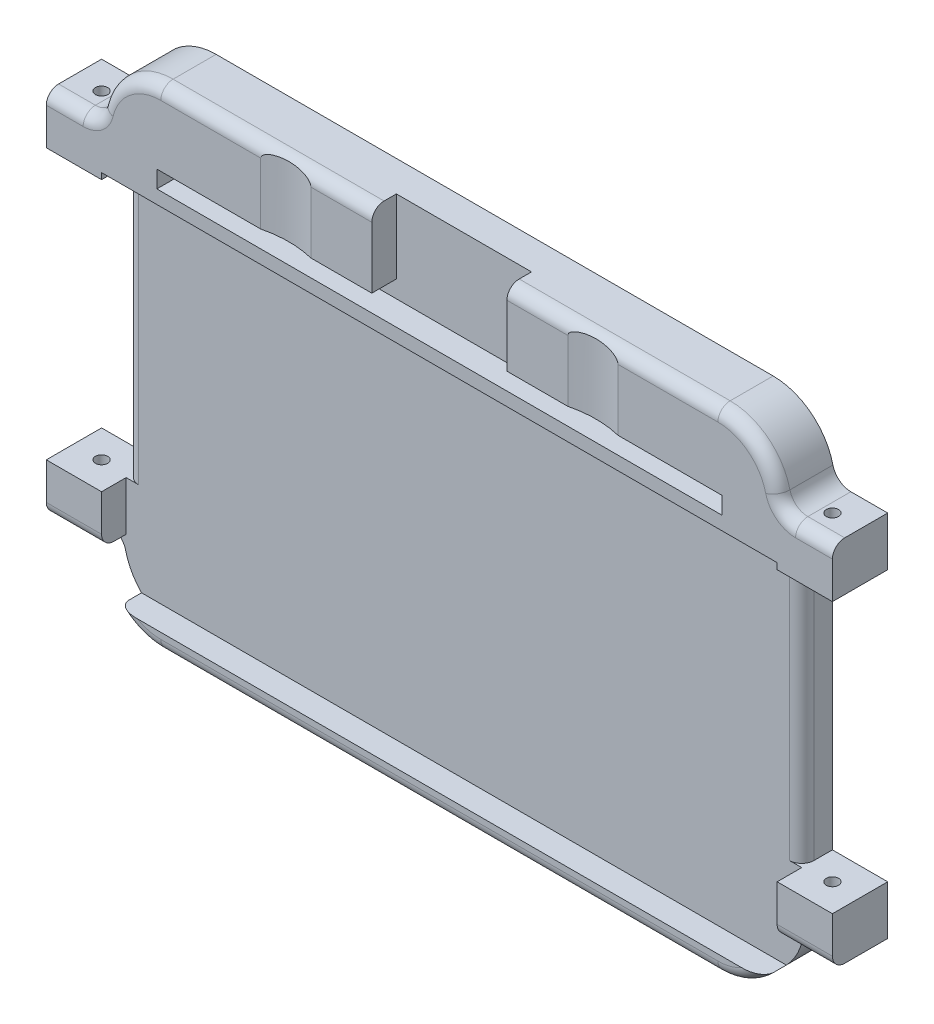
from build123d import *

# Parameters (mm, degrees)
SKETCH1_W           = 55
SKETCH1_H           = 40
BOSS_EXTRUDE1_DEPTH = 4.5
SKETCH2_W           = 46
SKETCH2_H           = 1.4
SKETCH2_W_2         = 55
SKETCH2_H_2         = 30
CUT_EXTRUDE1_DEPTH  = 2
CUT_EXTRUDE2_REACH  = 45.96
SKETCH3_R           = 8.5
SKETCH3_W           = 11
SKETCH3_H           = 5
SKETCH4_W           = 4.5
SKETCH4_H           = 4
BOSS_EXTRUDE2_DEPTH = 4.5
SKETCH5_R           = 0.5
CUT_EXTRUDE3_DEPTH  = 45.780017865
FILLET1_R           = 1.5
FILLET2_R           = 5
FILLET3_R           = 1
FILLET4_R           = 1


with BuildPart() as part:
    # Sketch1 → Boss-Extrude1 (new body)
    with BuildSketch(Plane.XY):
        Rectangle(SKETCH1_W, SKETCH1_H)
    extrude(amount=BOSS_EXTRUDE1_DEPTH)

    # Sketch2 → Cut-Extrude1 (cut)
    with BuildSketch(Plane.XY.offset(4.5)):
        with Locations((0, 13.3)):
            Rectangle(SKETCH2_W, SKETCH2_H)
        with Locations((0, -3.5)):
            Rectangle(SKETCH2_W_2, SKETCH2_H_2)
    extrude(amount=-CUT_EXTRUDE1_DEPTH, mode=Mode.SUBTRACT)

    # Sketch3 → Cut-Extrude2 (cut, up to next)
    with BuildSketch(Plane.XZ.offset(-14), mode=Mode.PRIVATE) as cut_extrude2_sk1:
        with Locations((-12.5, 12.75)):
            Circle(SKETCH3_R)
    cut_extrude2_tool1 = extrude(cut_extrude2_sk1.sketch, amount=-CUT_EXTRUDE2_REACH, mode=Mode.PRIVATE) & part.part
    # Sketch3 → Cut-Extrude2 (cut, up to next)
    with BuildSketch(Plane.XZ.offset(-14), mode=Mode.PRIVATE) as cut_extrude2_sk2:
        with Locations((12.5, 12.75)):
            Circle(SKETCH3_R)
    cut_extrude2_tool2 = extrude(cut_extrude2_sk2.sketch, amount=-CUT_EXTRUDE2_REACH, mode=Mode.PRIVATE) & part.part
    # Sketch3 → Cut-Extrude2 (cut, up to next)
    with BuildSketch(Plane.XZ.offset(-14), mode=Mode.PRIVATE) as cut_extrude2_sk3:
        with Locations((0, 5)):
            Rectangle(SKETCH3_W, SKETCH3_H)
    cut_extrude2_tool3 = extrude(cut_extrude2_sk3.sketch, amount=-CUT_EXTRUDE2_REACH, mode=Mode.PRIVATE) & part.part
    add(cut_extrude2_tool1.solids().sort_by_distance((-12.5, 14, 12.75))[0], mode=Mode.SUBTRACT)
    add(cut_extrude2_tool2.solids().sort_by_distance((12.5, 14, 12.75))[0], mode=Mode.SUBTRACT)
    add(cut_extrude2_tool3.solids().sort_by_distance((0, 14, 5))[0], mode=Mode.SUBTRACT)

    # Sketch4 → Boss-Extrude2 (add)
    with BuildSketch(Plane.ZY.offset(27.5)):
        with Locations((2.25, 13)):
            Rectangle(SKETCH4_W, SKETCH4_H)
        with Locations((2.25, -13)):
            Rectangle(SKETCH4_W, SKETCH4_H)
    boss_extrude2 = extrude(amount=BOSS_EXTRUDE2_DEPTH)

    # Sketch5 → Cut-Extrude3 (cut, symmetric)
    with BuildSketch(Plane.XZ.offset(-11)):
        with Locations(Location((-29.75, 2.25, 0), (0, 0, 270))):
            Circle(SKETCH5_R)
    cut_extrude3 = extrude(amount=CUT_EXTRUDE3_DEPTH, both=True, mode=Mode.SUBTRACT)

    # Mirror1: Boss-Extrude2, Cut-Extrude3 across plane
    add(boss_extrude2.mirror(Plane(origin=(0, 0, 0), x_dir=(0, 0, 1), z_dir=(1, 0, 0))))
    add(cut_extrude3.mirror(Plane(origin=(0, 0, 0), x_dir=(0, 0, 1), z_dir=(1, 0, 0))), mode=Mode.SUBTRACT)

    # Fillet1
    fillet1_edges = [part.edges().sort_by_distance(p)[0] for p in [
        (27.5, 15, 2.25),
        (27.5, -15, 1.25),
        (-27.5, 15, 2.25),
        (-27.5, -15, 1.25),
    ]]
    fillet(fillet1_edges, radius=FILLET1_R)

    # Fillet2
    # the kernel refuses this fillet: 5 mm, written as the material it takes off along each edge
    with BuildSketch(Plane(origin=(-27.5, 20, -12.061388301), x_dir=(1, 0, 0), z_dir=(0, 0, 1)), Plane(origin=(27.5, -20, -12.061388301), x_dir=(-1, 0, 0), z_dir=(0, 0, 1))) as fillet2_piece_1:
        with BuildLine():
            CenterArc((4.82455532, -5), FILLET2_R, 90, 76.657636203)
            Line((-0.040487234, -3.846153846), (-0.526991489, -3.730769231))
            ThreePointArc((-0.526991489, -3.730769231), (-0.5, -3.5), (-0.5, 0))
            Line((-0.5, 0), (0, 0.5))
            Line((0, 0.5), (4.82455532, 0.5))
            Line((4.82455532, 0.5), (4.82455532, 0))
        make_face()
    extrude(amount=28.622776602, mode=Mode.SUBTRACT)
    with BuildSketch(Plane(origin=(27.5, 20, -12.061388301), x_dir=(0.010526097592205859, -0.9999445991001099, 0), z_dir=(0, 0, 1)), Plane(origin=(-27.5, -20, -12.061388301), x_dir=(-0.010526097592205859, 0.9999445991001099, 0), z_dir=(0, 0, 1))) as fillet2_piece_2:
        with BuildLine():
            CenterArc((4.948939255, -4.876918524), FILLET2_R, 102.739251693, 76.657636203)
            Line((-0.05078374, -4.824288036), (-0.55075604, -4.819024987))
            Line((-0.55075604, -4.819024987), (-0.4999723, 0.005263049))
            Line((-0.4999723, 0.005263049), (0.005263049, 0.4999723))
            ThreePointArc((0.005263049, 0.4999723), (3.505069146, 0.463130958), (3.736109707, 0.487691852))
            Line((3.736109707, 0.487691852), (3.846366938, 0))
        make_face()
    extrude(amount=28.622776602, mode=Mode.SUBTRACT)

    # Fillet3
    fillet3_edges = [part.edges().sort_by_distance(p)[0] for p in [
        (27.5, 0, 2.5),
        (-27.5, 0, 2.5),
    ]]
    fillet(fillet3_edges, radius=FILLET3_R)

    # Fillet4
    # the kernel refuses this fillet: 1 mm, written as the material it takes off along each edge
    with BuildSketch(Plane(origin=(29, 15, 4.5), x_dir=(0, 0, -1), z_dir=(1, 0, 0))) as fillet4_piece_1:
        with BuildLine():
            CenterArc((FILLET4_R, -FILLET4_R), FILLET4_R, 90, 90)
            Line((0, -FILLET4_R), (0, 0))
            Line((0, 0), (FILLET4_R, 0))
        make_face()
    extrude(amount=5.5, mode=Mode.SUBTRACT)
    with BuildSketch(Plane(origin=(25, -15, 4.5), x_dir=(0, 0, -1), z_dir=(1, 0, 0)), Plane(origin=(-25, -15, 4.5), x_dir=(0, 1, 0), z_dir=(-1, 0, 0))) as fillet4_piece_2:
        with BuildLine():
            CenterArc((FILLET4_R, FILLET4_R), FILLET4_R, 180, 90)
            Line((0, FILLET4_R), (0, 0))
            Line((0, 0), (FILLET4_R, 0))
        make_face()
    extrude(amount=9.5, mode=Mode.SUBTRACT)
    with BuildSketch(Plane(origin=(29, 16.5, 4.5), x_dir=(0, -1, 0), z_dir=(1, 0, 0))) as fillet4_piece_3:
        with BuildLine():
            CenterArc((1.5 + FILLET4_R, FILLET4_R), FILLET4_R, 180, 90)
            Line((1.5 + FILLET4_R, 0), (1.5, 0))
            Line((1.5, 0), (1.5, FILLET4_R))
        make_face()
    revolve(axis=Axis((29, 16.5, 4.5), (0, 0, -1)), revolution_arc=76.657636203, mode=Mode.SUBTRACT)
    with BuildSketch(Plane(origin=(-29, 16.5, 4.5), x_dir=(0.9730085108210323, -0.23076923076926206, 0), z_dir=(0.23076923076926206, 0.9730085108210323, 0))) as fillet4_piece_4:
        with BuildLine():
            CenterArc((1.5 + FILLET4_R, FILLET4_R), FILLET4_R, 180, 90)
            Line((1.5 + FILLET4_R, 0), (1.5, 0))
            Line((1.5, 0), (1.5, FILLET4_R))
        make_face()
    revolve(axis=Axis((-29, 16.5, 4.5), (0, 0, -1)), revolution_arc=76.657636203, mode=Mode.SUBTRACT)
    with BuildSketch(Plane(origin=(22.67544468, 20, 4.5), x_dir=(0, 0, -1), z_dir=(-1, 0, 0)), Plane(origin=(-12.046338193, 20, 4.5), x_dir=(0, 0, -1), z_dir=(-1, 0, 0))) as fillet4_piece_5:
        with BuildLine():
            CenterArc((FILLET4_R, FILLET4_R), FILLET4_R, 180, 90)
            Line((0, FILLET4_R), (0, 0))
            Line((0, 0), (FILLET4_R, 0))
        make_face()
    extrude(amount=10.629106487, mode=Mode.SUBTRACT)
    with BuildSketch(Plane(origin=(22.67544468, 15, 4.5), x_dir=(0, 1, 0), z_dir=(-1, 0, 0))) as fillet4_piece_6:
        with BuildLine():
            CenterArc((5 - FILLET4_R, FILLET4_R), FILLET4_R, 270, 90)
            Line((5 - FILLET4_R, 0), (5, 0))
            Line((5, 0), (5, FILLET4_R))
        make_face()
    revolve(axis=Axis((22.67544468, 15, 4.5), (0, 0, -1)), revolution_arc=76.657636203, mode=Mode.SUBTRACT)
    with BuildSketch(Plane(origin=(-22.67544468, 15, 4.5), x_dir=(-0.9730085108210407, 0.2307692307692272, 0), z_dir=(-0.2307692307692272, -0.9730085108210407, 0))) as fillet4_piece_7:
        with BuildLine():
            CenterArc((5 - FILLET4_R, FILLET4_R), FILLET4_R, 270, 90)
            Line((5 - FILLET4_R, 0), (5, 0))
            Line((5, 0), (5, FILLET4_R))
        make_face()
    revolve(axis=Axis((-22.67544468, 15, 4.5), (0, 0, -1)), revolution_arc=76.657636203, mode=Mode.SUBTRACT)
    with BuildSketch(Plane(origin=(-22.67544468, -20, 4.5), x_dir=(0, 0, -1), z_dir=(1, 0, 0))) as fillet4_piece_8:
        with BuildLine():
            CenterArc((FILLET4_R, FILLET4_R), FILLET4_R, 180, 90)
            Line((0, FILLET4_R), (0, 0))
            Line((0, 0), (FILLET4_R, 0))
        make_face()
    extrude(amount=45.350889359, mode=Mode.SUBTRACT)
    with BuildSketch(Plane(origin=(-22.67544468, -15, 4.5), x_dir=(0, -1, 0), z_dir=(1, 0, 0))) as fillet4_piece_9:
        with BuildLine():
            CenterArc((5 - FILLET4_R, FILLET4_R), FILLET4_R, 270, 90)
            Line((5 - FILLET4_R, 0), (5, 0))
            Line((5, 0), (5, FILLET4_R))
        make_face()
    revolve(axis=Axis((-22.67544468, -15, 4.5), (0, 0, -1)), revolution_arc=74.223835896, mode=Mode.SUBTRACT)
    with BuildSketch(Plane(origin=(22.67544468, -15, 4.5), x_dir=(0.9623311828904709, -0.2718799265054833, 0), z_dir=(0.2718799265054833, 0.9623311828904709, 0))) as fillet4_piece_10:
        with BuildLine():
            CenterArc((5 - FILLET4_R, FILLET4_R), FILLET4_R, 270, 90)
            Line((5 - FILLET4_R, 0), (5, 0))
            Line((5, 0), (5, FILLET4_R))
        make_face()
    revolve(axis=Axis((22.67544468, -15, 4.5), (0, 0, -1)), revolution_arc=74.223835896, mode=Mode.SUBTRACT)
    with BuildSketch(Plane(origin=(12.953661807, 20, 4.5), x_dir=(0, 0, -1), z_dir=(-1, 0, 0)), Plane(origin=(-3, 20, 4.5), x_dir=(0, 0, -1), z_dir=(-1, 0, 0))) as fillet4_piece_11:
        with BuildLine():
            CenterArc((FILLET4_R, FILLET4_R), FILLET4_R, 180, 90)
            Line((0, FILLET4_R), (0, 0))
            Line((0, 0), (FILLET4_R, 0))
        make_face()
    extrude(amount=9.953661807, mode=Mode.SUBTRACT)
    with BuildSketch(Plane(origin=(-29, 15, 4.5), x_dir=(0, 0, -1), z_dir=(-1, 0, 0))) as fillet4_piece_12:
        with BuildLine():
            CenterArc((FILLET4_R, FILLET4_R), FILLET4_R, 180, 90)
            Line((0, FILLET4_R), (0, 0))
            Line((0, 0), (FILLET4_R, 0))
        make_face()
    extrude(amount=5.5, mode=Mode.SUBTRACT)


solid = part.part
